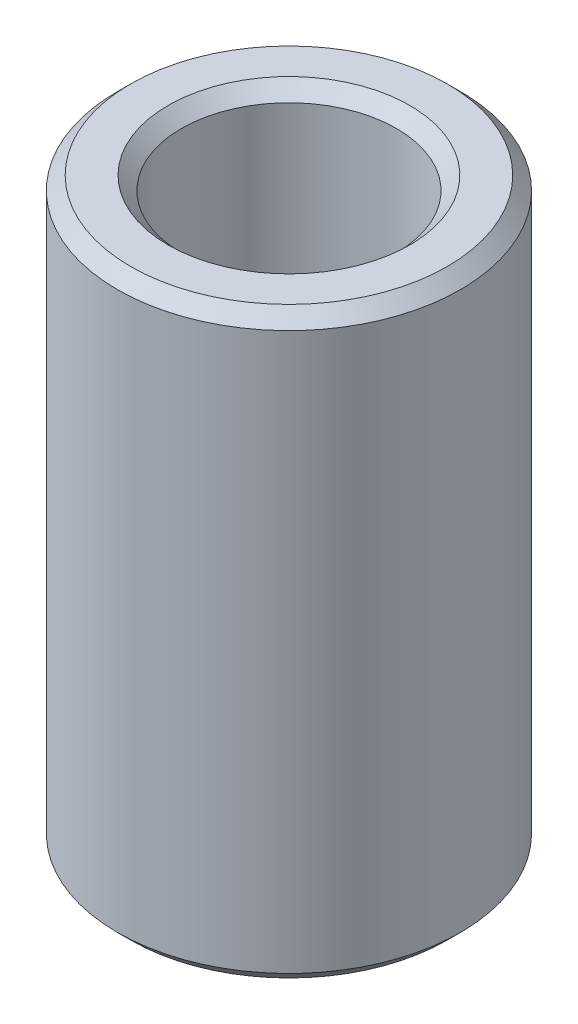
from build123d import *

# Parameters (mm, degrees)
SKETCH1_R           = 27.5
BOSS_EXTRUDE1_DEPTH = 93.506892961
SKETCH2_R           = 17.243402006
CUT_EXTRUDE1_DEPTH  = 102.272103915
CHAMFER1_SIZE       = 2.132583374


with BuildPart() as part:
    # Sketch1 → Boss-Extrude1 (new body)
    with BuildSketch(Plane(origin=(0, 0, 0), x_dir=(1, 0, 0), z_dir=(0, 1, 0))):
        Circle(SKETCH1_R)
    extrude(amount=BOSS_EXTRUDE1_DEPTH)

    # Sketch2 → Cut-Extrude1 (cut, through all)
    with BuildSketch(Plane(origin=(0, 0, 0), x_dir=(1, 0, 0), z_dir=(0, 1, 0))):
        Circle(SKETCH2_R)
    extrude(amount=CUT_EXTRUDE1_DEPTH, mode=Mode.SUBTRACT)

    # Chamfer1
    chamfer1_edges = [part.edges().sort_by_distance(p)[0] for p in [
        (-17.243402006, 93.506892961, 0),
        (-17.243402006, 0, 0),
        (-27.5, 0, 0),
        (-27.5, 93.506892961, 0),
    ]]
    chamfer(chamfer1_edges, length=CHAMFER1_SIZE)


solid = part.part
